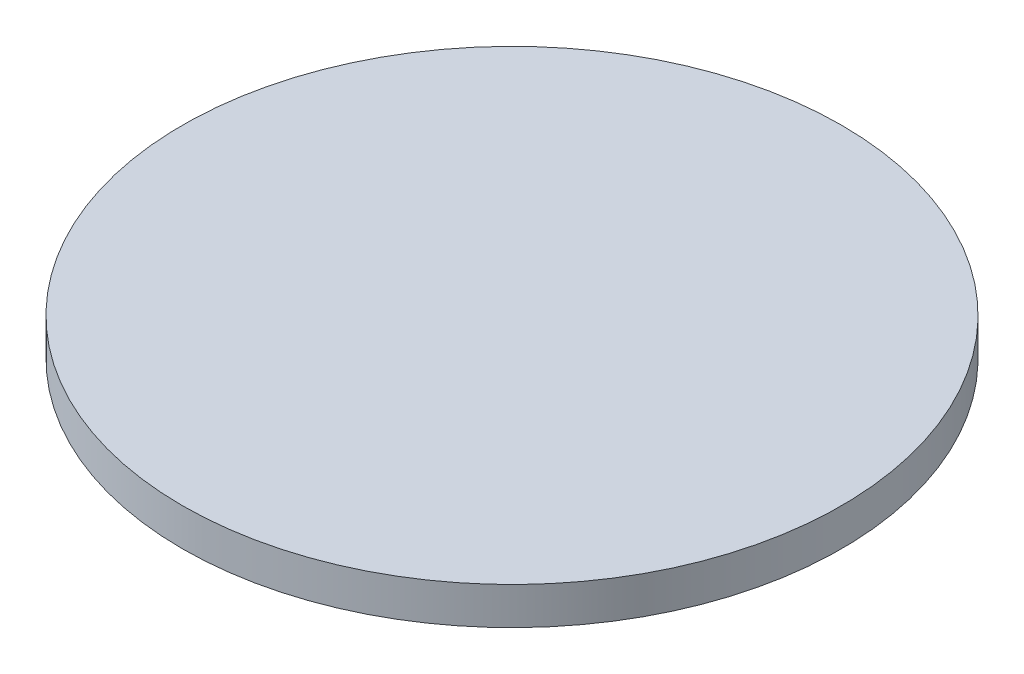
from build123d import *

# Parameters (mm, degrees)
SKETCH1_R           = 15.875
BOSS_EXTRUDE1_DEPTH = 1
BOSS_EXTRUDE2_START = 0.8
SKETCH2_R           = 15.875
SKETCH2_R_2         = 9.525
BOSS_EXTRUDE2_DEPTH = 0.8
THREAD1_PITCH       = 0.25


with BuildPart() as part:
    # Sketch1 → Boss-Extrude1 (new body)
    with BuildSketch(Plane(origin=(0, 0, 0), x_dir=(1, 0, 0), z_dir=(0, 1, 0))):
        with Locations(Location((0, 0, 0), (0, 0, 270))):
            Circle(SKETCH1_R)
    extrude(amount=BOSS_EXTRUDE1_DEPTH)

    # Sketch2 → Boss-Extrude2 (add)
    with BuildSketch(Plane.XZ.offset(BOSS_EXTRUDE2_START)):
        with Locations(Location((0, 0, 0), (0, 0, 270))):
            Circle(SKETCH2_R)
        with Locations(Location((0, 0, 0), (0, 0, 270))):
            Circle(SKETCH2_R_2, mode=Mode.SUBTRACT)
    extrude(amount=-BOSS_EXTRUDE2_DEPTH)

    # Thread1: the profile of Thread Profile1 profile screwed along a right-hand helix of 4 turns, 6 arcs to a turn; built about Z, then put on its axis
    thread1_z = Axis((0, 0, 0), (0, 0, 1))
    thread1_corners = [(9.5247, 0, -0.000173205), (9.660316469, 0, 0.078125), (9.660316469, 0, 0.109375), (9.5247, 0, 0.187673204)]
    with BuildLine(mode=Mode.PRIVATE) as thread1_profile:
        Line(thread1_corners[0], thread1_corners[1])
        Line(thread1_corners[1], thread1_corners[2])
        Line(thread1_corners[2], thread1_corners[3])
        Line(thread1_corners[3], thread1_corners[0])
    thread1_cap = Face(thread1_profile.wire())
    thread1_turn_angles = [0, 30, 60, 90, 120, 150, 180, 210, 240, 270, 300, 330, 360]
    thread1_turn_weights = [1, 0.8660254037844387, 1, 0.8660254037844387, 1, 0.8660254037844387, 1, 0.8660254037844387, 1, 0.8660254037844387, 1, 0.8660254037844387, 1]
    thread1_turn_rails = [Edge.make_bspline([Vector(p[0], p[1], 0).rotate(thread1_z, thread1_turn_angles[k]) / thread1_turn_weights[k] + Vector(0, 0, p[2] + THREAD1_PITCH * thread1_turn_angles[k] / 360) for k in range(13)], [0, 0, 0, 1, 1, 2, 2, 3, 3, 4, 4, 5, 5, 6, 6, 6], 2, thread1_turn_weights) for p in thread1_corners]
    thread1_turn_sides = [Face.make_surface_from_curves(thread1_turn_rails[p[0]], thread1_turn_rails[p[1]]) for p in [(0, 1), (1, 2), (2, 3), (3, 0)]]
    thread1 = Plane(origin=(0, -0.8, 0), x_dir=(1, 0, 0), z_dir=(0, 1, 0)) * Solid(Shell([*[p.moved(Location((0, 0, THREAD1_PITCH * i))) for i in range(4) for p in thread1_turn_sides], thread1_cap, thread1_cap.rotate(thread1_z, 1440).moved(Location((0, 0, THREAD1_PITCH * 1440 / 360)))]))
    add(thread1, mode=Mode.SUBTRACT)


solid = part.part
